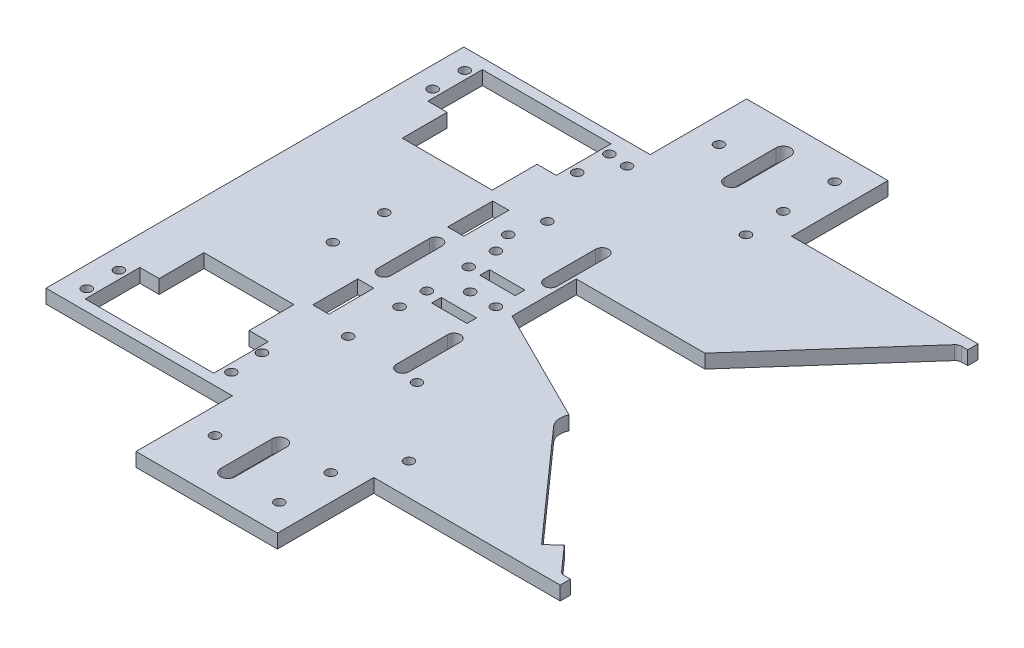
from build123d import *

# Parameters (mm, degrees)
BOSS_EXTRUDE1_DEPTH = 4.3
CUT_EXTRUDE1_DEPTH  = 4.5
FILLET1_R           = 2
CUT_EXTRUDE2_DEPTH  = 10
SKETCH8_R           = 1.5
CUT_EXTRUDE3_DEPTH  = 10
SKETCH9_R           = 1.5
CUT_EXTRUDE4_DEPTH  = 10
CUT_EXTRUDE5_DEPTH  = 10
SKETCH11_R          = 1.5
CUT_EXTRUDE6_DEPTH  = 10
SKETCH12_R          = 1.5
CUT_EXTRUDE7_DEPTH  = 10
SKETCH7_R           = 1.5
SKETCH7_W           = 11
SKETCH7_H           = 3
CUT_EXTRUDE8_DEPTH  = 9
SKETCH13_R          = 1.5
CUT_EXTRUDE9_DEPTH  = 10
SKETCH14_R          = 1.5
CUT_EXTRUDE10_DEPTH = 10
SKETCH15_W          = 5
SKETCH15_H          = 14
CUT_EXTRUDE11_DEPTH = 10


with BuildPart() as part:
    # Sketch2 → Boss-Extrude1 (new body)
    with BuildSketch(Plane(origin=(0, 0, 0), x_dir=(1, 0, 0), z_dir=(0, 1, 0))):
        Polygon((0, 0), (0, 65), (58, 65), (58, 95), (102, 95), (102, 65), (160, 65), (160, 0), align=None)
    extrude(amount=BOSS_EXTRUDE1_DEPTH)

    # Mirror1: part across plane


with BuildPart() as part_1:
    add(part.part)
    add(part.part.mirror(Plane(origin=(0, 4.3, 0), x_dir=(1, 0, 0), z_dir=(0, 0, -1))))

    # Sketch3 → Cut-Extrude1 (cut)
    with BuildSketch(Plane(origin=(0, 4.3, 0), x_dir=(1, 0, 0), z_dir=(0, 1, 0))):
        Polygon((160, -61.8), (160, 61.8), (157.156451185, 61.8), (120.012594795, 20), (80.012594795, 20), (80.012594795, 0), (120, -20), (157.155555556, -61.8), align=None)
    extrude(amount=-CUT_EXTRUDE1_DEPTH, mode=Mode.SUBTRACT)

    # Fillet1
    fillet1_edges = [part_1.edges().sort_by_distance(p)[0] for p in [
        (157.156451185, 2.15, -61.8),
        (157.155555556, 2.15, 61.8),
    ]]
    fillet(fillet1_edges, radius=FILLET1_R)

    # Sketch6 → Cut-Extrude2 (cut)
    with BuildSketch(Plane(origin=(0, 4.3, 0), x_dir=(1, 0, 0), z_dir=(0, 1, 0))):
        Polygon((9, -61.8), (49, -61.8), (49, -44.8), (43, -44.8), (43, -30.841820122), (15, -30.841820122), (15, -44.8), (9, -44.8), align=None)
        Polygon((9, 44.8), (15, 44.8), (15, 30.841820122), (43, 30.841820122), (43, 44.8), (49, 44.8), (49, 61.8), (9, 61.8), align=None)
    extrude(amount=-CUT_EXTRUDE2_DEPTH, mode=Mode.SUBTRACT)

    # Sketch8 → Cut-Extrude3 (cut)
    with BuildSketch(Plane(origin=(0, 4.3, 0), x_dir=(1, 0, 0), z_dir=(0, 1, 0))):
        with Locations((6.5, 58.8)):
            Circle(SKETCH8_R)
        with Locations((6.5, 48.8)):
            Circle(SKETCH8_R)
        with Locations((51.5, 48.8)):
            Circle(SKETCH8_R)
        with Locations((51.5, 58.8)):
            Circle(SKETCH8_R)
        with Locations((6.5, -48.8)):
            Circle(SKETCH8_R)
        with Locations((6.5, -58.8)):
            Circle(SKETCH8_R)
        with Locations((51.5, -58.8)):
            Circle(SKETCH8_R)
        with Locations((51, -48.8)):
            Circle(SKETCH8_R)
    extrude(amount=-CUT_EXTRUDE3_DEPTH, mode=Mode.SUBTRACT)

    # Sketch9 → Cut-Extrude4 (cut)
    with BuildSketch(Plane.XZ):
        with Locations((94, 70.4)):
            Circle(SKETCH9_R)
        with Locations((66, 78.4)):
            Circle(SKETCH9_R)
        with Locations((66, -78.4)):
            Circle(SKETCH9_R)
        with Locations((94, -86.4)):
            Circle(SKETCH9_R)
        with Locations((94, 86.4)):
            Circle(SKETCH9_R)
        with Locations((94, -70.4)):
            Circle(SKETCH9_R)
        with BuildLine():
            Line((75.75, 70.4), (75.75, 86.4))
            ThreePointArc((75.75, 86.4), (78, 88.65), (80.25, 86.4))
            Line((80.25, 86.4), (80.25, 70.4))
            ThreePointArc((80.25, 70.4), (78, 68.15), (75.75, 70.4))
        make_face()
        with BuildLine():
            Line((75.75, -86.4), (75.75, -70.4))
            ThreePointArc((75.75, -70.4), (78, -68.15), (80.25, -70.4))
            Line((80.25, -70.4), (80.25, -86.4))
            ThreePointArc((80.25, -86.4), (78, -88.65), (75.75, -86.4))
        make_face()
    extrude(amount=-CUT_EXTRUDE4_DEPTH, mode=Mode.SUBTRACT)

    # Sketch10 → Cut-Extrude5 (cut)
    with BuildSketch(Plane(origin=(0, 4.3, 0), x_dir=(1, 0, 0), z_dir=(0, 1, 0))):
        with BuildLine():
            Line((123.321819194, -23.737046593), (149.896372747, -53.633419341))
            Line((149.896372747, -53.633419341), (146.159326154, -56.955238535))
            Line((146.159326154, -56.955238535), (116.262953407, -23.321819194))
            ThreePointArc((116.262953407, -23.321819194), (120.29361011, -15.008628134), (123.321819194, -23.737046593))
        make_face()
    extrude(amount=-CUT_EXTRUDE5_DEPTH, mode=Mode.SUBTRACT)

    # Sketch11 → Cut-Extrude6 (cut)
    with BuildSketch(Plane.XZ):
        with BuildLine():
            ThreePointArc((79, 31.031280577), (77, 33.031280577), (75, 31.031280577))
            Line((75, 31.031280577), (75, 15.031280577))
            ThreePointArc((75, 15.031280577), (77, 13.031280577), (79, 15.031280577))
            Line((79, 15.031280577), (79, 31.031280577))
        make_face()
        with BuildLine():
            ThreePointArc((75, -31.031280577), (77, -33.031280577), (79, -31.031280577))
            Line((79, -31.031280577), (79, -15.031280577))
            ThreePointArc((79, -15.031280577), (77, -13.031280577), (75, -15.031280577))
            Line((75, -15.031280577), (75, -31.031280577))
        make_face()
        with Locations((60, 31)):
            Circle(SKETCH11_R)
        with Locations((60, 15)):
            Circle(SKETCH11_R)
        with Locations((60, -15)):
            Circle(SKETCH11_R)
        with Locations((60, -31)):
            Circle(SKETCH11_R)
    extrude(amount=-CUT_EXTRUDE6_DEPTH, mode=Mode.SUBTRACT)

    # Sketch12 → Cut-Extrude7 (cut)
    with BuildSketch(Plane(origin=(0, 0, 0), x_dir=(-1, 0, 0), z_dir=(0, -1, 0))):
        with BuildLine():
            ThreePointArc((-50.262723036, -8), (-48.262723036, -10), (-46.262723036, -8))
            Line((-46.262723036, -8), (-46.262723036, 8))
            ThreePointArc((-46.262723036, 8), (-48.262723036, 10), (-50.262723036, 8))
            Line((-50.262723036, 8), (-50.262723036, -8))
        make_face()
        with Locations((-32.262723036, -8)):
            Circle(SKETCH12_R)
        with Locations((-32.262723036, 8)):
            Circle(SKETCH12_R)
    extrude(amount=-CUT_EXTRUDE7_DEPTH, mode=Mode.SUBTRACT)

    # Sketch7 → Cut-Extrude8 (cut)
    with BuildSketch(Plane(origin=(0, 4.3, 0), x_dir=(1, 0, 0), z_dir=(0, 1, 0))):
        with Locations((60.012594795, -6.5)):
            Circle(SKETCH7_R)
        with Locations((60.012594795, 6.5)):
            Circle(SKETCH7_R)
        with Locations((69.5, -7.5)):
            Rectangle(SKETCH7_W, SKETCH7_H)
        with Locations((69.5, 7.5)):
            Rectangle(SKETCH7_W, SKETCH7_H)
    extrude(amount=-CUT_EXTRUDE8_DEPTH, mode=Mode.SUBTRACT)

    # Sketch13 → Cut-Extrude9 (cut)
    with BuildSketch(Plane(origin=(0, 4.3, 0), x_dir=(1, 0, 0), z_dir=(0, 1, 0))):
        with Locations((75, 0)):
            Circle(SKETCH13_R)
        with Locations((67, 0)):
            Circle(SKETCH13_R)
    extrude(amount=-CUT_EXTRUDE9_DEPTH, mode=Mode.SUBTRACT)

    # Sketch14 → Cut-Extrude10 (cut)
    with BuildSketch(Plane(origin=(0, 4.3, 0), x_dir=(1, 0, 0), z_dir=(0, 1, 0))):
        with Locations((57.5, 58.3)):
            Circle(SKETCH14_R)
        with Locations((94.5, 58.3)):
            Circle(SKETCH14_R)
        with Locations((57.5, 21.3)):
            Circle(SKETCH14_R)
        with Locations((83.127806945, -32.705958418)):
            Circle(SKETCH14_R)
        with Locations((103.05872211, -55.128237978)):
            Circle(SKETCH14_R)
    extrude(amount=-CUT_EXTRUDE10_DEPTH, mode=Mode.SUBTRACT)

    # Sketch15 → Cut-Extrude11 (cut)
    with BuildSketch(Plane(origin=(0, 4.3, 0), x_dir=(1, 0, 0), z_dir=(0, 1, 0))):
        with Locations((48.5, 21)):
            Rectangle(SKETCH15_W, SKETCH15_H)
        with Locations((48.5, -21)):
            Rectangle(SKETCH15_W, SKETCH15_H)
    extrude(amount=-CUT_EXTRUDE11_DEPTH, mode=Mode.SUBTRACT)


solid = part_1.part
